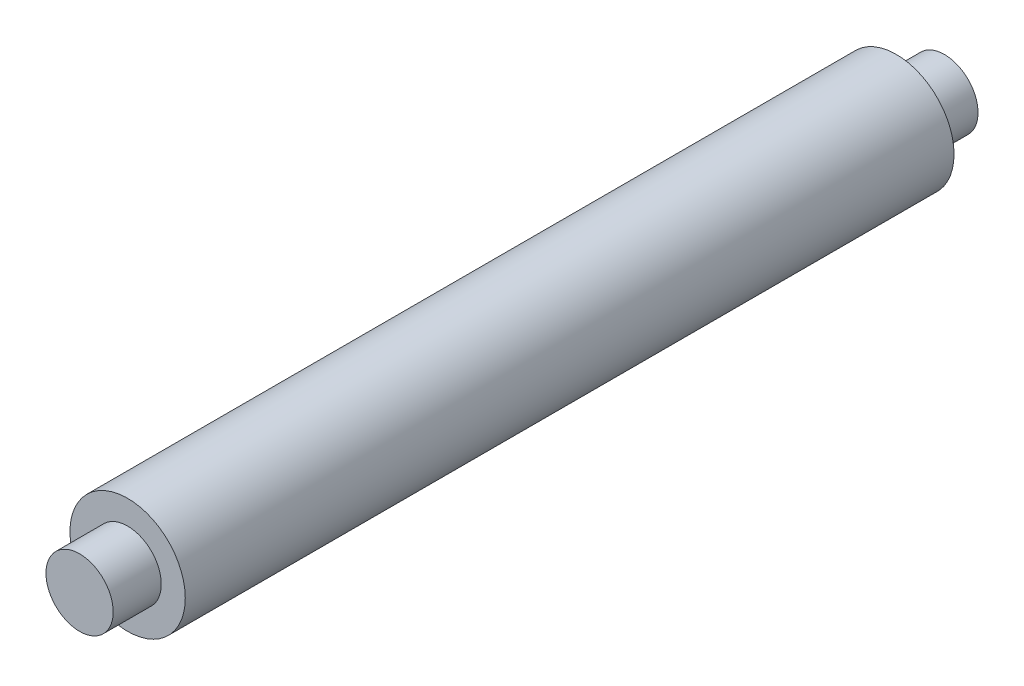
from build123d import *

# Parameters (mm, degrees)
CROQUIS1_R              = 24
SALIENTE_EXTRUIR1_DEPTH = 320
CROQUIS2_R              = 14
SALIENTE_EXTRUIR2_DEPTH = 20
SALIENTE_EXTRUIR3_START = 20
CROQUIS3_R              = 14
SALIENTE_EXTRUIR3_DEPTH = 20


with BuildPart() as part:
    # Croquis1 → Saliente-Extruir1 (new body)
    with BuildSketch(Plane.XY):
        Circle(CROQUIS1_R)
    extrude(amount=SALIENTE_EXTRUIR1_DEPTH)

    # Croquis2 → Saliente-Extruir2 (add)
    with BuildSketch(Plane(origin=(0, 0, 0), x_dir=(-1, 0, 0), z_dir=(0, 0, -1))):
        Circle(CROQUIS2_R)
    extrude(amount=SALIENTE_EXTRUIR2_DEPTH)

    # Croquis3 → Saliente-Extruir3 (add)
    with BuildSketch(Plane.XY.offset(320).offset(SALIENTE_EXTRUIR3_START)):
        Circle(CROQUIS3_R)
    extrude(amount=-SALIENTE_EXTRUIR3_DEPTH)


solid = part.part
